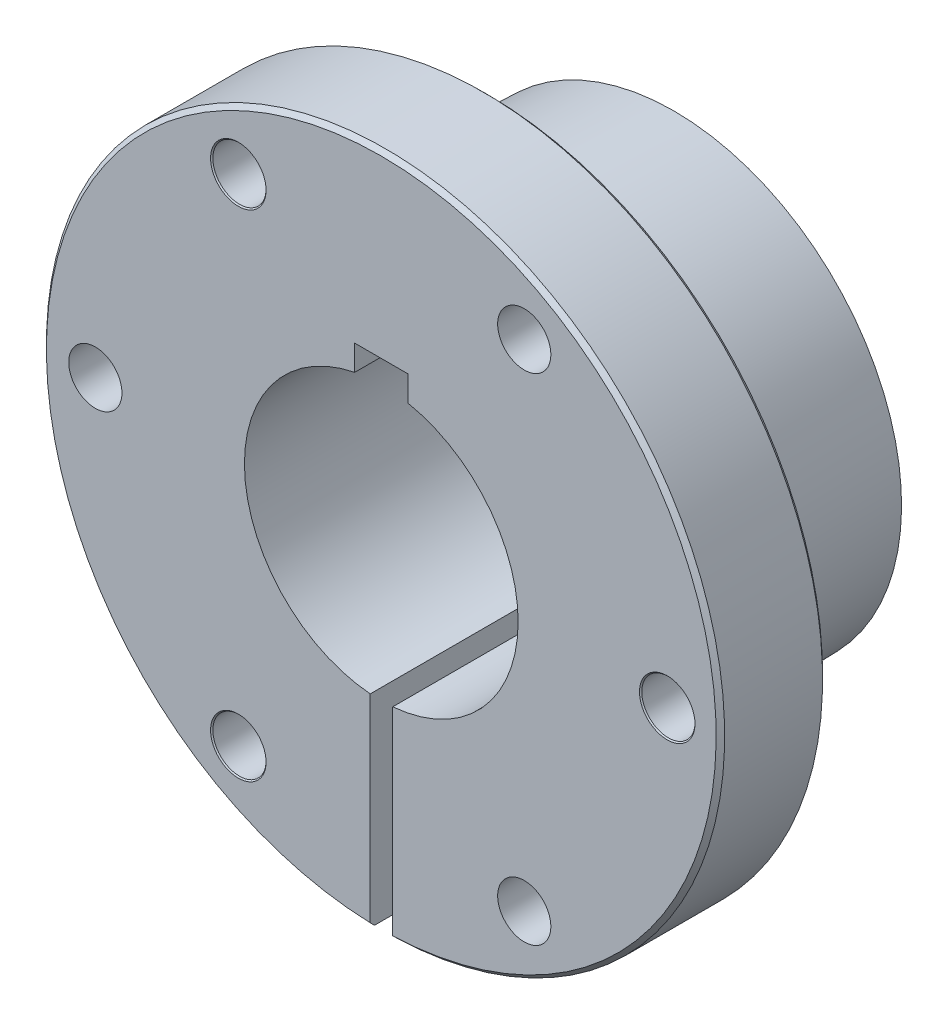
from build123d import *

# Parameters (mm, degrees)
SKETCH3_W           = 1.016
SKETCH3_H           = 40.48125
CUT_EXTRUDE1_DEPTH  = 68.06130649
CUT_EXTRUDE2_REACH  = 69.061
SKETCH4_R           = 3.175
CIRPATTERN1_COUNT   = 3
SKETCH16_W          = 6.35
SKETCH16_H          = 6.35
CUT_EXTRUDE7_DEPTH  = 68.06130649
SKETCH24_R          = 16.335149264
CUT_EXTRUDE13_DEPTH = 68.06130649
SKETCH25_W          = 2.685482999
SKETCH25_H          = 26.348135083
CUT_EXTRUDE14_DEPTH = 68.06130649


# Read off the part's stored shape, not the designer's step: Cut-Extrude3, Cut-Extrude4
with BuildPart() as part:
    # Sketch1 → Revolve1 (revolve)
    with BuildSketch(Plane(origin=(0, 0, 0), x_dir=(0, 0, -1), z_dir=(1, 0, 0)), mode=Mode.PRIVATE) as revolve1_sk:
        Polygon((34.925, -27.1795875), (15.875, -27.7749), (15.875, -26.98115), (12.7, -26.98115), (12.7, -39.97325), (12.192, -40.48125), (0.508, -40.48125), (0, -39.97325), (0, -15.875), (34.925, -15.875), align=None)
    revolve(revolve1_sk.sketch.rotate(Axis((0, 0, 0), (0, 0, -1)), 270), axis=Axis((0, 0, 0), (0, 0, -1)))

    # Sketch3 → Cut-Extrude1 (cut, through all)
    with BuildSketch(Plane.XY):
        with Locations((0, -20.240625)):
            Rectangle(SKETCH3_W, SKETCH3_H)
    extrude(amount=-CUT_EXTRUDE1_DEPTH, mode=Mode.SUBTRACT)

    # Sketch4 → Cut-Extrude2 (cut, up to next)
    with BuildSketch(Plane.XY, mode=Mode.PRIVATE) as cut_extrude2_sk1:
        with Locations((34.13125, 0)):
            Circle(SKETCH4_R)
    cut_extrude2_tool1 = extrude(cut_extrude2_sk1.sketch, amount=-CUT_EXTRUDE2_REACH, mode=Mode.PRIVATE) & part.part
    # Sketch4 → Cut-Extrude2 (cut, up to next)
    with BuildSketch(Plane.XY, mode=Mode.PRIVATE) as cut_extrude2_sk2:
        with Locations((-34.13125, 0)):
            Circle(SKETCH4_R)
    cut_extrude2_tool2 = extrude(cut_extrude2_sk2.sketch, amount=-CUT_EXTRUDE2_REACH, mode=Mode.PRIVATE) & part.part
    cut_extrude2_1 = cut_extrude2_tool1.solids().sort_by_distance((34.13125, 0, 0))[0]
    add(cut_extrude2_1, mode=Mode.SUBTRACT)
    cut_extrude2_2 = cut_extrude2_tool2.solids().sort_by_distance((-34.13125, 0, 0))[0]
    add(cut_extrude2_2, mode=Mode.SUBTRACT)
    cut_extrude2 = cut_extrude2_1 + cut_extrude2_2  # Cut-Extrude2 as one shape, for the pattern or mirror that repeats it

    # Cut-Extrude3 outline → Cut-Extrude3 (revolve, cut)
    with BuildSketch(Plane(origin=(34.13125, 0, 0), x_dir=(1, 0, 0), z_dir=(0, -1, 0))):
        Polygon((3.175, 0), (3.175, -0.137481533), (3.312481533, 0), align=None)
    cut_extrude3 = revolve(axis=Axis((34.13125, 0, 0), (0, 0, 1)), mode=Mode.SUBTRACT)

    # Cut-Extrude4 outline → Cut-Extrude4 (revolve, cut)
    with BuildSketch(Plane(origin=(34.13125, 0, 0), x_dir=(1, 0, 0), z_dir=(0, -1, 0))):
        Polygon((3.312481533, -12.7), (3.175, -12.562518467), (3.175, -12.7), align=None)
    cut_extrude4 = revolve(axis=Axis((34.13125, 0, 0), (0, 0, 1)), mode=Mode.SUBTRACT)

    # CirPattern1: Cut-Extrude2, Cut-Extrude3, Cut-Extrude4 ×3 about axis
    cirpattern1_axis = Axis((0, 0, 0), (0, 0, 1))
    add([cut_extrude2.rotate(cirpattern1_axis, i * 360 / CIRPATTERN1_COUNT) for i in range(1, CIRPATTERN1_COUNT)], mode=Mode.SUBTRACT)
    add([cut_extrude3.rotate(cirpattern1_axis, i * 360 / CIRPATTERN1_COUNT) for i in range(1, CIRPATTERN1_COUNT)], mode=Mode.SUBTRACT)
    add([cut_extrude4.rotate(cirpattern1_axis, i * 360 / CIRPATTERN1_COUNT) for i in range(1, CIRPATTERN1_COUNT)], mode=Mode.SUBTRACT)

    # Sketch16 → Cut-Extrude7 (cut, through all)
    with BuildSketch(Plane.XY):
        with Locations((0, 15.875)):
            Rectangle(SKETCH16_W, SKETCH16_H)
    extrude(amount=-CUT_EXTRUDE7_DEPTH, mode=Mode.SUBTRACT)

    # Sketch24 → Cut-Extrude13 (cut, through all)
    with BuildSketch(Plane.XY):
        Circle(SKETCH24_R)
    extrude(amount=-CUT_EXTRUDE13_DEPTH, mode=Mode.SUBTRACT)

    # Sketch25 → Cut-Extrude14 (cut, through all)
    with BuildSketch(Plane.XY):
        with Locations((0.025334746, -28.373320916)):
            Rectangle(SKETCH25_W, SKETCH25_H)
    extrude(amount=-CUT_EXTRUDE14_DEPTH, mode=Mode.SUBTRACT)


solid = part.part
